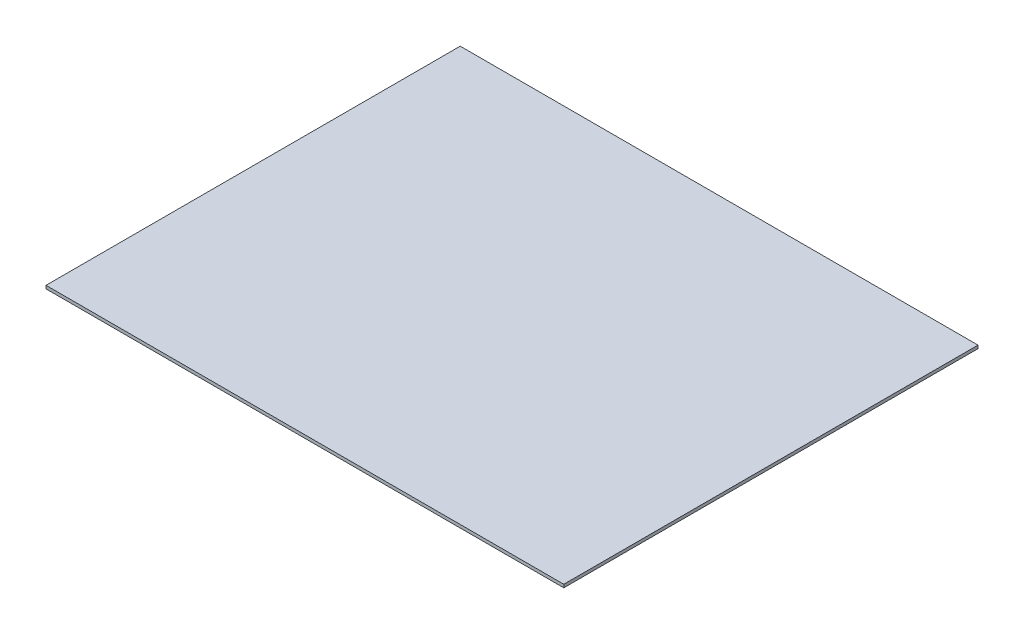
from build123d import *

# Parameters (mm, degrees)
BOSS_EXTRUDE1_DEPTH             = 479.425
BOSS_EXTRUDE1_2_DEPTH           = 479.425
SKETCH2_R                       = 1.5875
SKETCH2_W                       = 5.588
SKETCH2_H                       = 25.4
BOSS_EXTRUDE2_DEPTH             = 3.175
SKETCH3_R                       = 1.5875
BOSS_EXTRUDE3_DEPTH             = 3.175
SKETCH4_R                       = 1.5875
BOSS_EXTRUDE4_DEPTH             = 3.175
BOSS_EXTRUDE5_DEPTH             = 3.175
SKETCH6_R                       = 1.5875
BOSS_EXTRUDE6_DEPTH             = 3.175
BOSS_EXTRUDE8_RIGHT_START       = -0.762
SKETCH8_W                       = 3.175
SKETCH8_H                       = 25.4
BOSS_EXTRUDE8_RIGHT_DEPTH       = 5.588
BOSS_EXTRUDE8_LEFT_START        = -189.738
BOSS_EXTRUDE8_LEFT_OUTLINE_W    = 3.175
BOSS_EXTRUDE8_LEFT_OUTLINE_H    = 25.4
BOSS_EXTRUDE8_LEFT_DEPTH        = 5.588
BASE_FLANGE1_DEPTH              = 482.6
BASE_FLANGE2_DEPTH              = 482.6
SKETCH13_W                      = 0.762
SKETCH13_H                      = 63.5
BASE_FLANGE3_DEPTH              = 482.6
HOLE1_START                     = 93
HOLE1_OUTLINE_R                 = 1.7526
HOLE1_DEPTH                     = 3
HOLE1_START_2                   = 88
HOLE1_2_OUTLINE_R               = 1.7526
HOLE1_2_DEPTH                   = 7
SKETCH24_W                      = 1.35255
SKETCH24_H                      = 184.15
F_6_32_TAPPED_HOLE1_AT_2_COUNT  = 2
F_6_32_TAPPED_HOLE1_AT_2_PITCH  = 152.4
F_6_32_TAPPED_HOLE1_AT_3_COUNT  = 2
F_6_32_TAPPED_HOLE1_AT_3_PITCH  = 304.8
F_6_32_TAPPED_HOLE1_AT_4_COUNT  = 2
F_6_32_TAPPED_HOLE1_AT_4_PITCH  = 457.2
HOLE2_START                     = -96
HOLE2_OUTLINE_R                 = 1.7526
HOLE2_DEPTH                     = 192
HOLE2_START_2                   = -95
HOLE2_2_OUTLINE_R               = 1.7526
HOLE2_2_DEPTH                   = 7
HOLE2_START_3                   = 88
HOLE2_3_OUTLINE_R               = 1.7526
HOLE2_3_DEPTH                   = 7
SKETCH26_W                      = 1.35255
SKETCH26_H                      = 184.15
F_6_32_TAPPED_HOLE2_AT_2_COUNT  = 2
F_6_32_TAPPED_HOLE2_AT_2_PITCH  = 50.8
F_6_32_TAPPED_HOLE2_AT_3_COUNT  = 2
F_6_32_TAPPED_HOLE2_AT_3_PITCH  = 101.6
F_6_32_TAPPED_HOLE2_AT_4_COUNT  = 2
F_6_32_TAPPED_HOLE2_AT_4_PITCH  = 152.4
F_6_32_TAPPED_HOLE2_AT_5_COUNT  = 2
F_6_32_TAPPED_HOLE2_AT_5_PITCH  = 203.2
F_6_32_TAPPED_HOLE2_AT_6_COUNT  = 2
F_6_32_TAPPED_HOLE2_AT_6_PITCH  = 254
F_6_32_TAPPED_HOLE2_AT_7_COUNT  = 2
F_6_32_TAPPED_HOLE2_AT_7_PITCH  = 304.8
F_6_32_TAPPED_HOLE2_AT_8_COUNT  = 2
F_6_32_TAPPED_HOLE2_AT_8_PITCH  = 355.6
F_6_32_TAPPED_HOLE2_AT_9_COUNT  = 2
F_6_32_TAPPED_HOLE2_AT_9_PITCH  = 406.4
F_6_32_TAPPED_HOLE2_AT_10_COUNT = 2
F_6_32_TAPPED_HOLE2_AT_10_PITCH = 457.2
SKETCH21_W                      = 1.35255
SKETCH21_H                      = 3.176
F_6_32_TAPPED_HOLE3_AT_2_COUNT  = 2
F_6_32_TAPPED_HOLE3_AT_2_PITCH  = 25.4
F_6_32_TAPPED_HOLE3_AT_3_COUNT  = 2
F_6_32_TAPPED_HOLE3_AT_3_PITCH  = 50.8
F_6_32_TAPPED_HOLE3_AT_4_COUNT  = 2
F_6_32_TAPPED_HOLE3_AT_4_PITCH  = 76.2
F_6_32_TAPPED_HOLE3_AT_5_COUNT  = 2
F_6_32_TAPPED_HOLE3_AT_5_PITCH  = 101.6
F_6_32_TAPPED_HOLE3_AT_6_COUNT  = 2
F_6_32_TAPPED_HOLE3_AT_6_PITCH  = 127
F_6_32_TAPPED_HOLE3_AT_7_COUNT  = 2
F_6_32_TAPPED_HOLE3_AT_7_PITCH  = 203.2
F_6_32_TAPPED_HOLE3_AT_8_COUNT  = 2
F_6_32_TAPPED_HOLE3_AT_8_PITCH  = 152.4
F_6_32_TAPPED_HOLE3_AT_9_COUNT  = 2
F_6_32_TAPPED_HOLE3_AT_9_PITCH  = 177.8
F_6_32_TAPPED_HOLE3_AT_10_COUNT = 2
F_6_32_TAPPED_HOLE3_AT_10_PITCH = 254
F_6_32_TAPPED_HOLE3_AT_11_COUNT = 2
F_6_32_TAPPED_HOLE3_AT_11_PITCH = 279.4
F_6_32_TAPPED_HOLE3_AT_12_COUNT = 2
F_6_32_TAPPED_HOLE3_AT_12_PITCH = 304.8
F_6_32_TAPPED_HOLE3_AT_13_COUNT = 2
F_6_32_TAPPED_HOLE3_AT_13_PITCH = 330.2
F_6_32_TAPPED_HOLE3_AT_14_COUNT = 2
F_6_32_TAPPED_HOLE3_AT_14_PITCH = 355.6
F_6_32_TAPPED_HOLE3_AT_15_COUNT = 2
F_6_32_TAPPED_HOLE3_AT_15_PITCH = 381
F_6_32_TAPPED_HOLE3_AT_16_COUNT = 2
F_6_32_TAPPED_HOLE3_AT_16_PITCH = 406.4
F_6_32_TAPPED_HOLE3_AT_17_COUNT = 2
F_6_32_TAPPED_HOLE3_AT_17_PITCH = 431.8
MIRROR1_COPY_1_SKETCH_W         = 1.35255
MIRROR1_COPY_1_SKETCH_H         = 3.176
MIRROR1_COPY_2_SKETCH_W         = 1.35255
MIRROR1_COPY_2_SKETCH_H         = 3.176
MIRROR1_COPY_3_SKETCH_W         = 1.35255
MIRROR1_COPY_3_SKETCH_H         = 3.176
MIRROR1_COPY_4_SKETCH_W         = 1.35255
MIRROR1_COPY_4_SKETCH_H         = 3.176
MIRROR1_COPY_5_SKETCH_W         = 1.35255
MIRROR1_COPY_5_SKETCH_H         = 3.176
MIRROR1_COPY_6_SKETCH_W         = 1.35255
MIRROR1_COPY_6_SKETCH_H         = 3.176
MIRROR1_COPY_7_SKETCH_W         = 1.35255
MIRROR1_COPY_7_SKETCH_H         = 3.176
MIRROR1_COPY_8_SKETCH_W         = 1.35255
MIRROR1_COPY_8_SKETCH_H         = 3.176
MIRROR1_COPY_9_SKETCH_W         = 1.35255
MIRROR1_COPY_9_SKETCH_H         = 3.176
MIRROR1_COPY_10_SKETCH_W        = 1.35255
MIRROR1_COPY_10_SKETCH_H        = 3.176
MIRROR1_COPY_11_SKETCH_W        = 1.35255
MIRROR1_COPY_11_SKETCH_H        = 3.176
MIRROR1_COPY_12_SKETCH_W        = 1.35255
MIRROR1_COPY_12_SKETCH_H        = 3.176
MIRROR1_COPY_13_SKETCH_W        = 1.35255
MIRROR1_COPY_13_SKETCH_H        = 3.176
MIRROR1_COPY_14_SKETCH_W        = 1.35255
MIRROR1_COPY_14_SKETCH_H        = 3.176
MIRROR1_COPY_15_SKETCH_W        = 1.35255
MIRROR1_COPY_15_SKETCH_H        = 3.176
MIRROR1_COPY_16_SKETCH_W        = 1.35255
MIRROR1_COPY_16_SKETCH_H        = 3.176
SKETCH9_R                       = 1.5875
NOSECONE_BASE_DEPTH             = 3.175
NOSECONE_BASE_DRAFT             = 20
SPLIT1_START                    = -558.8
SPLIT1_DEPTH                    = 361.95
SPLIT1_START_2                  = -679.45
SPLIT1_2_DEPTH                  = 120.65
SPLIT1_3_OUTLINE_W              = 127
SPLIT1_3_OUTLINE_H              = 0.762
SPLIT1_3_DEPTH                  = 19.05


with BuildPart() as part:
    # Sketch1 → Boss-Extrude1 (new body)
    with BuildSketch(Plane.XY.offset(-196.85)):
        Polygon((88.9, -136.525), (85.725, -136.525), (85.725, -114.3), (63.5, -114.3), (63.5, -111.125), (88.9, -111.125), align=None)
    extrude(amount=-BOSS_EXTRUDE1_DEPTH)

    # Sketch24 → #6-32 Tapped Hole1 (revolve, cut)
    with BuildSketch(Plane(origin=(88.9, -117.475, -209.55), x_dir=(0, 0, -1), z_dir=(0, 1, 0))):
        with Locations((0.676275, 92.075)):
            Rectangle(SKETCH24_W, SKETCH24_H)
    f_6_32_tapped_hole1 = revolve(axis=Axis((95.25, -117.475, -209.55), (-1, 0, 0)), mode=Mode.SUBTRACT)

    # #6-32 Tapped Hole1 at 2: #6-32 Tapped Hole1 ×2
    with Locations(*[(0, 0, -i * F_6_32_TAPPED_HOLE1_AT_2_PITCH) for i in range(1, F_6_32_TAPPED_HOLE1_AT_2_COUNT)]):
        add(f_6_32_tapped_hole1, mode=Mode.SUBTRACT)

    # #6-32 Tapped Hole1 at 3: #6-32 Tapped Hole1 ×2
    with Locations(*[(0, 0, -i * F_6_32_TAPPED_HOLE1_AT_3_PITCH) for i in range(1, F_6_32_TAPPED_HOLE1_AT_3_COUNT)]):
        add(f_6_32_tapped_hole1, mode=Mode.SUBTRACT)

    # #6-32 Tapped Hole1 at 4: #6-32 Tapped Hole1 ×2
    with Locations(*[(0, 0, -i * F_6_32_TAPPED_HOLE1_AT_4_PITCH) for i in range(1, F_6_32_TAPPED_HOLE1_AT_4_COUNT)]):
        add(f_6_32_tapped_hole1, mode=Mode.SUBTRACT)


with BuildPart() as body_2:
    # Sketch1 → Boss-Extrude1 2 (new body)
    with BuildSketch(Plane.XY.offset(-196.85)):
        Polygon((-63.5, -114.3), (-63.5, -111.125), (-88.9, -111.125), (-88.9, -136.525), (-85.725, -136.525), (-85.725, -114.3), align=None)
    extrude(amount=-BOSS_EXTRUDE1_2_DEPTH)


with BuildPart() as body_3:
    # Sketch2 → Boss-Extrude2 (new body)
    # profile 1 of 3: a face of its own
    with BuildSketch(Plane.XY.offset(-196.85)):
        with BuildLine():
            Line((94.488, -171.45), (94.488, -136.525))
            Line((94.488, -136.525), (88.9, -136.525))
            Line((88.9, -136.525), (85.725, -136.525))
            Line((85.725, -136.525), (85.725, -114.3))
            Line((85.725, -114.3), (63.5, -114.3))
            Line((63.5, -114.3), (63.5, -111.125))
            Line((63.5, -111.125), (88.9, -111.125))
            Line((88.9, -111.125), (88.9, -85.725))
            Line((88.9, -85.725), (88.9, -60.325))
            Line((88.9, -60.325), (94.488, -60.325))
            Line((94.488, -60.325), (94.488, -25.4))
            ThreePointArc((94.488, -25.4), (87.271696875, -7.978303125), (69.85, -0.762))
            Line((69.85, -0.762), (-69.85, -0.762))
            ThreePointArc((-69.85, -0.762), (-87.271696875, -7.978303125), (-94.488, -25.4))
            Line((-94.488, -25.4), (-94.488, -60.325))
            Line((-94.488, -60.325), (-88.9, -60.325))
            Line((-88.9, -60.325), (-88.9, -85.725))
            Line((-88.9, -85.725), (-94.488, -85.725))
            Line((-94.488, -85.725), (-94.488, -111.125))
            Line((-94.488, -111.125), (-88.9, -111.125))
            Line((-88.9, -111.125), (-63.5, -111.125))
            Line((-63.5, -111.125), (-63.5, -114.3))
            Line((-63.5, -114.3), (-85.725, -114.3))
            Line((-85.725, -114.3), (-85.725, -136.525))
            Line((-85.725, -136.525), (-88.9, -136.525))
            Line((-88.9, -136.525), (-94.488, -136.525))
            Line((-94.488, -136.525), (-94.488, -171.45))
            ThreePointArc((-94.488, -171.45), (-87.271696875, -188.871696875), (-69.85, -196.088))
            Line((-69.85, -196.088), (69.85, -196.088))
            ThreePointArc((69.85, -196.088), (87.271696875, -188.871696875), (94.488, -171.45))
        make_face()
        with Locations((-19.05, -155.575)):
            Circle(SKETCH2_R, mode=Mode.SUBTRACT)
        with Locations((-19.05, -127)):
            Circle(SKETCH2_R, mode=Mode.SUBTRACT)
        with Locations((19.05, -155.575)):
            Circle(SKETCH2_R, mode=Mode.SUBTRACT)
        with Locations((19.05, -127)):
            Circle(SKETCH2_R, mode=Mode.SUBTRACT)
        with Locations((-83.82, -84.836714101)):
            Circle(SKETCH2_R, mode=Mode.SUBTRACT)
        with BuildLine():
            ThreePointArc((-64.77, -88.9), (-68.362102448, -87.412102448), (-69.85, -83.82))
            Line((-69.85, -83.82), (-69.85, -54.309589078))
            ThreePointArc((-69.85, -54.309589078), (-66.714031836, -49.616281053), (-61.177897552, -50.71748663))
            Line((-61.177897552, -50.71748663), (-31.66748663, -80.227897552))
            ThreePointArc((-31.66748663, -80.227897552), (-30.566281053, -85.764031836), (-35.259589078, -88.9))
            Line((-35.259589078, -88.9), (-64.77, -88.9))
        make_face(mode=Mode.SUBTRACT)
        with BuildLine():
            ThreePointArc((-50.88251337, -34.072102448), (-51.983718947, -28.535968164), (-47.290410922, -25.4))
            Line((-47.290410922, -25.4), (47.290410922, -25.4))
            ThreePointArc((47.290410922, -25.4), (51.983718947, -28.535968164), (50.88251337, -34.072102448))
            Line((50.88251337, -34.072102448), (3.592102448, -81.36251337))
            ThreePointArc((3.592102448, -81.36251337), (0, -82.850410922), (-3.592102448, -81.36251337))
            Line((-3.592102448, -81.36251337), (-50.88251337, -34.072102448))
        make_face(mode=Mode.SUBTRACT)
        with Locations((-19.05, -12.7)):
            Circle(SKETCH2_R, mode=Mode.SUBTRACT)
        with BuildLine():
            Line((64.77, -88.9), (35.259589078, -88.9))
            ThreePointArc((35.259589078, -88.9), (30.566281053, -85.764031836), (31.66748663, -80.227897552))
            Line((31.66748663, -80.227897552), (61.177897552, -50.71748663))
            ThreePointArc((61.177897552, -50.71748663), (66.714031836, -49.616281053), (69.85, -54.309589078))
            Line((69.85, -54.309589078), (69.85, -83.82))
            ThreePointArc((69.85, -83.82), (68.362102448, -87.412102448), (64.77, -88.9))
        make_face(mode=Mode.SUBTRACT)
        with Locations((19.05, -12.7)):
            Circle(SKETCH2_R, mode=Mode.SUBTRACT)
    # profile 2 of 3: a face of its own
    with BuildSketch(Plane.XY.offset(-196.85)):
        with Locations((91.694, -98.425)):
            Rectangle(SKETCH2_W, SKETCH2_H)
    # profile 3 of 3: a face of its own
    with BuildSketch(Plane.XY.offset(-196.85)):
        with BuildLine():
            Line((94.488, -171.45), (94.488, -136.525))
            Line((94.488, -136.525), (88.9, -136.525))
            Line((88.9, -136.525), (85.725, -136.525))
            Line((85.725, -136.525), (85.725, -114.3))
            Line((85.725, -114.3), (63.5, -114.3))
            Line((63.5, -114.3), (63.5, -111.125))
            Line((63.5, -111.125), (88.9, -111.125))
            Line((88.9, -111.125), (88.9, -85.725))
            Line((88.9, -85.725), (88.9, -60.325))
            Line((88.9, -60.325), (94.488, -60.325))
            Line((94.488, -60.325), (94.488, -25.4))
            ThreePointArc((94.488, -25.4), (87.271696875, -7.978303125), (69.85, -0.762))
            Line((69.85, -0.762), (-69.85, -0.762))
            ThreePointArc((-69.85, -0.762), (-87.271696875, -7.978303125), (-94.488, -25.4))
            Line((-94.488, -25.4), (-94.488, -60.325))
            Line((-94.488, -60.325), (-88.9, -60.325))
            Line((-88.9, -60.325), (-88.9, -85.725))
            Line((-88.9, -85.725), (-94.488, -85.725))
            Line((-94.488, -85.725), (-94.488, -111.125))
            Line((-94.488, -111.125), (-88.9, -111.125))
            Line((-88.9, -111.125), (-63.5, -111.125))
            Line((-63.5, -111.125), (-63.5, -114.3))
            Line((-63.5, -114.3), (-85.725, -114.3))
            Line((-85.725, -114.3), (-85.725, -136.525))
            Line((-85.725, -136.525), (-88.9, -136.525))
            Line((-88.9, -136.525), (-94.488, -136.525))
            Line((-94.488, -136.525), (-94.488, -171.45))
            ThreePointArc((-94.488, -171.45), (-87.271696875, -188.871696875), (-69.85, -196.088))
            Line((-69.85, -196.088), (69.85, -196.088))
            ThreePointArc((69.85, -196.088), (87.271696875, -188.871696875), (94.488, -171.45))
        make_face()
        with Locations((-19.05, -155.575)):
            Circle(SKETCH2_R, mode=Mode.SUBTRACT)
        with Locations((-19.05, -127)):
            Circle(SKETCH2_R, mode=Mode.SUBTRACT)
        with Locations((19.05, -155.575)):
            Circle(SKETCH2_R, mode=Mode.SUBTRACT)
        with Locations((19.05, -127)):
            Circle(SKETCH2_R, mode=Mode.SUBTRACT)
        with Locations((-83.82, -84.836714101)):
            Circle(SKETCH2_R, mode=Mode.SUBTRACT)
        with BuildLine():
            ThreePointArc((-64.77, -88.9), (-68.362102448, -87.412102448), (-69.85, -83.82))
            Line((-69.85, -83.82), (-69.85, -54.309589078))
            ThreePointArc((-69.85, -54.309589078), (-66.714031836, -49.616281053), (-61.177897552, -50.71748663))
            Line((-61.177897552, -50.71748663), (-31.66748663, -80.227897552))
            ThreePointArc((-31.66748663, -80.227897552), (-30.566281053, -85.764031836), (-35.259589078, -88.9))
            Line((-35.259589078, -88.9), (-64.77, -88.9))
        make_face(mode=Mode.SUBTRACT)
        with BuildLine():
            ThreePointArc((-50.88251337, -34.072102448), (-51.983718947, -28.535968164), (-47.290410922, -25.4))
            Line((-47.290410922, -25.4), (47.290410922, -25.4))
            ThreePointArc((47.290410922, -25.4), (51.983718947, -28.535968164), (50.88251337, -34.072102448))
            Line((50.88251337, -34.072102448), (3.592102448, -81.36251337))
            ThreePointArc((3.592102448, -81.36251337), (0, -82.850410922), (-3.592102448, -81.36251337))
            Line((-3.592102448, -81.36251337), (-50.88251337, -34.072102448))
        make_face(mode=Mode.SUBTRACT)
        with Locations((-19.05, -12.7)):
            Circle(SKETCH2_R, mode=Mode.SUBTRACT)
        with BuildLine():
            Line((64.77, -88.9), (35.259589078, -88.9))
            ThreePointArc((35.259589078, -88.9), (30.566281053, -85.764031836), (31.66748663, -80.227897552))
            Line((31.66748663, -80.227897552), (61.177897552, -50.71748663))
            ThreePointArc((61.177897552, -50.71748663), (66.714031836, -49.616281053), (69.85, -54.309589078))
            Line((69.85, -54.309589078), (69.85, -83.82))
            ThreePointArc((69.85, -83.82), (68.362102448, -87.412102448), (64.77, -88.9))
        make_face(mode=Mode.SUBTRACT)
        with Locations((19.05, -12.7)):
            Circle(SKETCH2_R, mode=Mode.SUBTRACT)
    extrude(amount=-BOSS_EXTRUDE2_DEPTH)


with BuildPart() as body_4:
    # Sketch3 → Boss-Extrude3 (new body)
    with BuildSketch(Plane.XY.offset(-450.85)):
        Polygon((88.9, -111.125), (63.5, -111.125), (63.5, -114.3), (85.725, -114.3), (85.725, -136.525), (-85.725, -136.525), (-85.725, -114.3), (-63.5, -114.3), (-63.5, -111.125), (-88.9, -111.125), (-94.488, -111.125), (-94.488, -85.725), (-88.9, -85.725), (-88.9, -60.325), (88.9, -60.325), (88.9, -85.725), (94.488, -85.725), (94.488, -111.125), align=None)
        with Locations((-83.82, -84.836714101)):
            Circle(SKETCH3_R, mode=Mode.SUBTRACT)
        with BuildLine():
            Line((-25.4, -85.725), (25.4, -85.725))
            ThreePointArc((25.4, -85.725), (38.1, -98.425), (25.4, -111.125))
            Line((25.4, -111.125), (-25.4, -111.125))
            ThreePointArc((-25.4, -111.125), (-38.1, -98.425), (-25.4, -85.725))
        make_face(mode=Mode.SUBTRACT)
    extrude(amount=BOSS_EXTRUDE3_DEPTH)


with BuildPart() as body_5:
    # Sketch4 → Boss-Extrude4 (new body)
    with BuildSketch(Plane.XY.offset(-679.45)):
        with BuildLine():
            Line((88.9, -136.525), (88.9, -111.125))
            Line((88.9, -111.125), (94.488, -111.125))
            Line((94.488, -111.125), (94.488, -85.725))
            Line((94.488, -85.725), (88.9, -85.725))
            Line((88.9, -85.725), (88.9, -60.325))
            Line((88.9, -60.325), (94.488, -60.325))
            Line((94.488, -60.325), (94.488, -25.4))
            ThreePointArc((94.488, -25.4), (87.271696875, -7.978303125), (69.85, -0.762))
            Line((69.85, -0.762), (-69.85, -0.762))
            ThreePointArc((-69.85, -0.762), (-87.271696875, -7.978303125), (-94.488, -25.4))
            Line((-94.488, -25.4), (-94.488, -60.325))
            Line((-94.488, -60.325), (-88.9, -60.325))
            Line((-88.9, -60.325), (-88.9, -85.725))
            Line((-88.9, -85.725), (-94.488, -85.725))
            Line((-94.488, -85.725), (-94.488, -111.125))
            Line((-94.488, -111.125), (-88.9, -111.125))
            Line((-88.9, -111.125), (-88.9, -136.525))
            Line((-88.9, -136.525), (-94.488, -136.525))
            Line((-94.488, -136.525), (-94.488, -171.45))
            ThreePointArc((-94.488, -171.45), (-87.271696875, -188.871696875), (-69.85, -196.088))
            Line((-69.85, -196.088), (69.85, -196.088))
            ThreePointArc((69.85, -196.088), (87.271696875, -188.871696875), (94.488, -171.45))
            Line((94.488, -171.45), (94.488, -136.525))
            Line((94.488, -136.525), (88.9, -136.525))
        make_face()
        with Locations((25.4, -184.15)):
            Circle(SKETCH4_R, mode=Mode.SUBTRACT)
        with Locations(Location((-25.4, -184.15, 0), (0, 0, 180))):
            Circle(SKETCH4_R, mode=Mode.SUBTRACT)
        with Locations(Location((-63.1655201, -45.2492872, 0), (0, 0, 180))):
            Circle(SKETCH4_R, mode=Mode.SUBTRACT)
        with Locations(Location((-63.1655201, -133.35, 0), (0, 0, 180))):
            Circle(SKETCH4_R, mode=Mode.SUBTRACT)
        with Locations((63.1655201, -45.2492872)):
            Circle(SKETCH4_R, mode=Mode.SUBTRACT)
        with Locations((63.1655201, -133.35)):
            Circle(SKETCH4_R, mode=Mode.SUBTRACT)
        with Locations((-83.82, -84.836714101)):
            Circle(SKETCH4_R, mode=Mode.SUBTRACT)
        with BuildLine():
            Line((-3.271622644, -113.630048555), (-49.273936974, -152.356965567))
            ThreePointArc((-49.273936974, -152.356965567), (-50.774552528, -157.984513496), (-46.00231433, -161.323208647))
            Line((-46.00231433, -161.323208647), (46.00231433, -161.323208647))
            ThreePointArc((46.00231433, -161.323208647), (50.774552528, -157.984513496), (49.273936974, -152.356965567))
            Line((49.273936974, -152.356965567), (3.271622644, -113.630048555))
            ThreePointArc((3.271622644, -113.630048555), (0, -112.436291635), (-3.271622644, -113.630048555))
        make_face(mode=Mode.SUBTRACT)
        with BuildLine():
            Line((-46.00231433, -35.526791353), (46.00231433, -35.526791353))
            ThreePointArc((46.00231433, -35.526791353), (50.774552528, -38.865486504), (49.273936974, -44.493034433))
            Line((49.273936974, -44.493034433), (3.271622644, -83.219951445))
            ThreePointArc((3.271622644, -83.219951445), (0, -84.413708365), (-3.271622644, -83.219951445))
            Line((-3.271622644, -83.219951445), (-49.273936974, -44.493034433))
            ThreePointArc((-49.273936974, -44.493034433), (-50.774552528, -38.865486504), (-46.00231433, -35.526791353))
        make_face(mode=Mode.SUBTRACT)
        with BuildLine():
            Line((25.440586882, -89.45875692), (54.813897456, -64.730919255))
            ThreePointArc((54.813897456, -64.730919255), (60.228713625, -64.011391876), (63.1655201, -68.617162335))
            Line((63.1655201, -68.617162335), (63.1655201, -93.345))
            ThreePointArc((63.1655201, -93.345), (61.677622548, -96.937102448), (58.0855201, -98.425))
            Line((58.0855201, -98.425), (28.712209526, -98.425))
            ThreePointArc((28.712209526, -98.425), (23.939971328, -95.086304849), (25.440586882, -89.45875692))
        make_face(mode=Mode.SUBTRACT)
        with BuildLine():
            Line((-63.1655201, -68.617162335), (-63.1655201, -93.345))
            ThreePointArc((-63.1655201, -93.345), (-61.677622548, -96.937102448), (-58.0855201, -98.425))
            Line((-58.0855201, -98.425), (-28.712209526, -98.425))
            ThreePointArc((-28.712209526, -98.425), (-23.939971328, -95.086304849), (-25.440586882, -89.45875692))
            Line((-25.440586882, -89.45875692), (-54.813897456, -64.730919255))
            ThreePointArc((-54.813897456, -64.730919255), (-60.228713625, -64.011391876), (-63.1655201, -68.617162335))
        make_face(mode=Mode.SUBTRACT)
    extrude(amount=BOSS_EXTRUDE4_DEPTH)


with BuildPart() as body_6:
    # Sketch5 → Boss-Extrude5 (new body)
    with BuildSketch(Plane.XY.offset(-450.85)):
        with BuildLine():
            Line((69.85, -0.762), (69.85, -1.203250218))
            ThreePointArc((69.85, -1.203250218), (83.566, -10.002068321), (88.9, -25.4))
            Line((88.9, -25.4), (88.9, -60.325))
            Line((88.9, -60.325), (94.488, -60.325))
            Line((94.488, -60.325), (94.488, -25.4))
            ThreePointArc((94.488, -25.4), (87.271696875, -7.978303125), (69.85, -0.762))
        make_face()
    extrude(amount=-BOSS_EXTRUDE5_DEPTH)


with BuildPart() as body_7:
    # Sketch6 → Boss-Extrude6 (new body)
    with BuildSketch(Plane.XY.offset(-450.85)):
        with BuildLine():
            Line((-94.488, -25.4), (-94.488, -59.98389124))
            ThreePointArc((-94.488, -59.98389124), (-66.117668406, -64.389306336), (-57.695875243, -91.836652233))
            Line((-57.695875243, -91.836652233), (-61.777576564, -96.701034447))
            Line((-61.777576564, -96.701034447), (-80.554638943, -80.94520833))
            ThreePointArc((-80.554638943, -80.94520833), (-87.711505771, -81.571353044), (-87.085361057, -88.728219872))
            Line((-87.085361057, -88.728219872), (-68.308298678, -104.484045989))
            Line((-68.308298678, -104.484045989), (-58.302651908, -106.248311474))
            Line((-58.302651908, -106.248311474), (-50.955589529, -97.492423489))
            ThreePointArc((-50.955589529, -97.492423489), (-45.450014055, -78.708264177), (-55.529491864, -61.928510619))
            Line((-55.529491864, -61.928510619), (-78.407186312, -45.704558542))
            ThreePointArc((-78.407186312, -45.704558542), (-88.452181648, -20.699611978), (-69.85, -1.203250218))
            Line((-69.85, -1.203250218), (-69.85, -0.762))
            ThreePointArc((-69.85, -0.762), (-87.271696875, -7.978303125), (-94.488, -25.4))
        make_face()
        with Locations((-83.82, -84.836714101)):
            Circle(SKETCH6_R, mode=Mode.SUBTRACT)
    extrude(amount=-BOSS_EXTRUDE6_DEPTH)


with BuildPart() as body_8:
    # Sketch8 → Boss-Extrude8-Right (new body)
    with BuildSketch(Plane(origin=(95.25, 0, 0), x_dir=(0, 0, -1), z_dir=(1, 0, 0)).offset(BOSS_EXTRUDE8_RIGHT_START)):
        Polygon((196.85, -60.325), (679.45, -60.325), (679.45, -85.725), (676.275, -85.725), (676.275, -111.125), (679.45, -111.125), (679.45, -136.525), (196.85, -136.525), (196.85, -111.125), (200.025, -111.125), (200.025, -85.725), (196.85, -85.725), align=None)
        with Locations((449.2625, -98.425)):
            Rectangle(SKETCH8_W, SKETCH8_H, mode=Mode.SUBTRACT)
    extrude(amount=-BOSS_EXTRUDE8_RIGHT_DEPTH)

    # Hole1 2 outline → Hole1 2 (cut)
    with BuildSketch(Plane.YZ.offset(HOLE1_START_2)):
        with Locations((-117.475, -666.75)):
            Circle(HOLE1_2_OUTLINE_R)
        with Locations((-117.475, -514.35)):
            Circle(HOLE1_2_OUTLINE_R)
        with Locations((-117.475, -361.95)):
            Circle(HOLE1_2_OUTLINE_R)
        with Locations((-117.475, -209.55)):
            Circle(HOLE1_2_OUTLINE_R)
    extrude(amount=HOLE1_2_DEPTH, mode=Mode.SUBTRACT)

    # Hole2 3 outline → Hole2 3 (cut)
    with BuildSketch(Plane.YZ.offset(HOLE2_START_3)):
        with Locations((-130.175, -666.75)):
            Circle(HOLE2_3_OUTLINE_R)
        with Locations((-130.175, -615.95)):
            Circle(HOLE2_3_OUTLINE_R)
        with Locations((-130.175, -565.15)):
            Circle(HOLE2_3_OUTLINE_R)
        with Locations((-130.175, -514.35)):
            Circle(HOLE2_3_OUTLINE_R)
        with Locations((-130.175, -463.55)):
            Circle(HOLE2_3_OUTLINE_R)
        with Locations((-130.175, -412.75)):
            Circle(HOLE2_3_OUTLINE_R)
        with Locations((-130.175, -361.95)):
            Circle(HOLE2_3_OUTLINE_R)
        with Locations((-130.175, -311.15)):
            Circle(HOLE2_3_OUTLINE_R)
        with Locations((-130.175, -260.35)):
            Circle(HOLE2_3_OUTLINE_R)
        with Locations((-130.175, -209.55)):
            Circle(HOLE2_3_OUTLINE_R)
    extrude(amount=HOLE2_3_DEPTH, mode=Mode.SUBTRACT)


with BuildPart() as body_9:
    # Boss-Extrude8-Left: read off the stored shape, not the designer's step
    # Boss-Extrude8-Left outline → Boss-Extrude8-Left (new body)
    with BuildSketch(Plane(origin=(95.25, 0, 0), x_dir=(0, 0, -1), z_dir=(1, 0, 0)).offset(BOSS_EXTRUDE8_LEFT_START)):
        Polygon((196.85, -60.325), (196.85, -85.725), (200.025, -85.725), (200.025, -111.125), (196.85, -111.125), (196.85, -136.525), (679.45, -136.525), (679.45, -111.125), (676.275, -111.125), (676.275, -85.725), (679.45, -85.725), (679.45, -60.325), align=None)
        with Locations((449.2625, -98.425)):
            Rectangle(BOSS_EXTRUDE8_LEFT_OUTLINE_W, BOSS_EXTRUDE8_LEFT_OUTLINE_H, mode=Mode.SUBTRACT)
    extrude(amount=BOSS_EXTRUDE8_LEFT_DEPTH)

    # Hole2 2 outline → Hole2 2 (cut)
    with BuildSketch(Plane.YZ.offset(HOLE2_START_2)):
        with Locations((-130.175, -666.75)):
            Circle(HOLE2_2_OUTLINE_R)
        with Locations((-130.175, -615.95)):
            Circle(HOLE2_2_OUTLINE_R)
        with Locations((-130.175, -565.15)):
            Circle(HOLE2_2_OUTLINE_R)
        with Locations((-130.175, -514.35)):
            Circle(HOLE2_2_OUTLINE_R)
        with Locations((-130.175, -463.55)):
            Circle(HOLE2_2_OUTLINE_R)
        with Locations((-130.175, -412.75)):
            Circle(HOLE2_2_OUTLINE_R)
        with Locations((-130.175, -361.95)):
            Circle(HOLE2_2_OUTLINE_R)
        with Locations((-130.175, -311.15)):
            Circle(HOLE2_2_OUTLINE_R)
        with Locations((-130.175, -260.35)):
            Circle(HOLE2_2_OUTLINE_R)
        with Locations((-130.175, -209.55)):
            Circle(HOLE2_2_OUTLINE_R)
    extrude(amount=HOLE2_2_DEPTH, mode=Mode.SUBTRACT)


with BuildPart() as body_10:
    # Base-Flange1: sheet metal written as solids
    # Sketch11 → Base-Flange1 (new body)
    with BuildSketch(Plane.XY.offset(-196.85)):
        with BuildLine():
            Line((95.25, -123.825), (95.25, -25.4))
            ThreePointArc((95.25, -25.4), (87.810512242, -7.439487758), (69.85, 0))
            Line((69.85, 0), (-69.85, 0))
            ThreePointArc((-69.85, 0), (-87.810512242, -7.439487758), (-95.25, -25.4))
            Line((-95.25, -25.4), (-95.25, -60.325))
            Line((-95.25, -60.325), (-94.488, -60.325))
            Line((-94.488, -60.325), (-94.488, -25.4))
            ThreePointArc((-94.488, -25.4), (-87.271696875, -7.978303125), (-69.85, -0.762))
            Line((-69.85, -0.762), (69.85, -0.762))
            ThreePointArc((69.85, -0.762), (87.271696875, -7.978303125), (94.488, -25.4))
            Line((94.488, -25.4), (94.488, -123.825))
            Line((94.488, -123.825), (95.25, -123.825))
        make_face()
    extrude(amount=-BASE_FLANGE1_DEPTH)

    # Hole1: read off the stored shape, not the designer's step
    # Hole1 outline → Hole1 (cut)
    with BuildSketch(Plane.YZ.offset(HOLE1_START)):
        with Locations((-117.475, -666.75)):
            Circle(HOLE1_OUTLINE_R)
        with Locations((-117.475, -514.35)):
            Circle(HOLE1_OUTLINE_R)
        with Locations((-117.475, -361.95)):
            Circle(HOLE1_OUTLINE_R)
        with Locations((-117.475, -209.55)):
            Circle(HOLE1_OUTLINE_R)
    extrude(amount=HOLE1_DEPTH, mode=Mode.SUBTRACT)


with BuildPart() as body_11:
    # Base-Flange2: sheet metal written as solids
    # Sketch12 → Base-Flange2 (new body)
    with BuildSketch(Plane.XY.offset(-196.85)):
        with BuildLine():
            Line((-95.25, -123.825), (-95.25, -171.45))
            ThreePointArc((-95.25, -171.45), (-87.810512242, -189.410512242), (-69.85, -196.85))
            Line((-69.85, -196.85), (69.85, -196.85))
            ThreePointArc((69.85, -196.85), (87.810512242, -189.410512242), (95.25, -171.45))
            Line((95.25, -171.45), (95.25, -123.825))
            Line((95.25, -123.825), (94.488, -123.825))
            Line((94.488, -123.825), (94.488, -171.45))
            ThreePointArc((94.488, -171.45), (87.271696875, -188.871696875), (69.85, -196.088))
            Line((69.85, -196.088), (-69.85, -196.088))
            ThreePointArc((-69.85, -196.088), (-87.271696875, -188.871696875), (-94.488, -171.45))
            Line((-94.488, -171.45), (-94.488, -123.825))
            Line((-94.488, -123.825), (-95.25, -123.825))
        make_face()
    extrude(amount=-BASE_FLANGE2_DEPTH)

    # Hole2: read off the stored shape, not the designer's step
    # Hole2 outline → Hole2 (cut)
    with BuildSketch(Plane.YZ.offset(HOLE2_START)):
        with Locations((-130.175, -666.75)):
            Circle(HOLE2_OUTLINE_R)
        with Locations((-130.175, -615.95)):
            Circle(HOLE2_OUTLINE_R)
        with Locations((-130.175, -565.15)):
            Circle(HOLE2_OUTLINE_R)
        with Locations((-130.175, -514.35)):
            Circle(HOLE2_OUTLINE_R)
        with Locations((-130.175, -463.55)):
            Circle(HOLE2_OUTLINE_R)
        with Locations((-130.175, -412.75)):
            Circle(HOLE2_OUTLINE_R)
        with Locations((-130.175, -361.95)):
            Circle(HOLE2_OUTLINE_R)
        with Locations((-130.175, -311.15)):
            Circle(HOLE2_OUTLINE_R)
        with Locations((-130.175, -260.35)):
            Circle(HOLE2_OUTLINE_R)
        with Locations((-130.175, -209.55)):
            Circle(HOLE2_OUTLINE_R)
    extrude(amount=HOLE2_DEPTH, mode=Mode.SUBTRACT)

    # Split1: read off the stored shape, not the designer's step
    # Split1 outline → Split1 (cut)
    with BuildSketch(Plane.XY.offset(SPLIT1_START)):
        with BuildLine():
            Line((69.85, -196.088), (-69.85, -196.088))
            ThreePointArc((-69.85, -196.088), (-87.271696875, -188.871696875), (-94.488, -171.45))
            Line((-94.488, -171.45), (-94.488, -123.825))
            Line((-94.488, -123.825), (-95.25, -123.825))
            Line((-95.25, -123.825), (-95.25, -171.45))
            ThreePointArc((-95.25, -171.45), (-87.810512242, -189.410512242), (-69.85, -196.85))
            Line((-69.85, -196.85), (69.85, -196.85))
            ThreePointArc((69.85, -196.85), (87.810512242, -189.410512242), (95.25, -171.45))
            Line((95.25, -171.45), (95.25, -123.825))
            Line((95.25, -123.825), (94.488, -123.825))
            Line((94.488, -123.825), (94.488, -171.45))
            ThreePointArc((94.488, -171.45), (87.271696875, -188.871696875), (69.85, -196.088))
        make_face()
    extrude(amount=SPLIT1_DEPTH, mode=Mode.SUBTRACT)

    # Split1 2 outline → Split1 2 (cut)
    with BuildSketch(Plane.XY.offset(SPLIT1_START_2)):
        with BuildLine():
            Line((69.85, -196.088), (63.5, -196.088))
            Line((63.5, -196.088), (63.5, -196.85))
            Line((63.5, -196.85), (69.85, -196.85))
            ThreePointArc((69.85, -196.85), (87.810512242, -189.410512242), (95.25, -171.45))
            Line((95.25, -171.45), (95.25, -123.825))
            Line((95.25, -123.825), (94.488, -123.825))
            Line((94.488, -123.825), (94.488, -171.45))
            ThreePointArc((94.488, -171.45), (87.271696875, -188.871696875), (69.85, -196.088))
        make_face()
        with BuildLine():
            Line((-63.5, -196.85), (-63.5, -196.088))
            Line((-63.5, -196.088), (-69.85, -196.088))
            ThreePointArc((-69.85, -196.088), (-87.271696875, -188.871696875), (-94.488, -171.45))
            Line((-94.488, -171.45), (-94.488, -123.825))
            Line((-94.488, -123.825), (-95.25, -123.825))
            Line((-95.25, -123.825), (-95.25, -171.45))
            ThreePointArc((-95.25, -171.45), (-87.810512242, -189.410512242), (-69.85, -196.85))
            Line((-69.85, -196.85), (-63.5, -196.85))
        make_face()
    extrude(amount=SPLIT1_2_DEPTH, mode=Mode.SUBTRACT)

    # Split1 3 outline → Split1 3 (cut)
    with BuildSketch(Plane.XY.offset(SPLIT1_START_2)):
        with Locations((0, -196.469)):
            Rectangle(SPLIT1_3_OUTLINE_W, SPLIT1_3_OUTLINE_H)
    extrude(amount=SPLIT1_3_DEPTH, mode=Mode.SUBTRACT)


with BuildPart() as body_12:
    # Base-Flange3: sheet metal written as solids
    # Sketch13 → Base-Flange3 (new body)
    with BuildSketch(Plane.XY.offset(-196.85)):
        with Locations((-94.869, -92.075)):
            Rectangle(SKETCH13_W, SKETCH13_H)
    extrude(amount=-BASE_FLANGE3_DEPTH)


with BuildPart() as f_6_32_tapped_hole2_tool:
    # Sketch26 → #6-32 Tapped Hole2 (revolve)
    with BuildSketch(Plane(origin=(88.9, -130.175, -209.55), x_dir=(0, 0, -1), z_dir=(0, 1, 0))):
        with Locations((0.676275, 92.075)):
            Rectangle(SKETCH26_W, SKETCH26_H)
    f_6_32_tapped_hole2 = revolve(axis=Axis((95.25, -130.175, -209.55), (-1, 0, 0)))


with BuildPart() as part_1:
    add(part.part)

    # #6-32 Tapped Hole2: cut by f_6_32_tapped_hole2_tool
    add(f_6_32_tapped_hole2_tool.part, mode=Mode.SUBTRACT)


with BuildPart() as body_2_1:
    add(body_2.part)

    # #6-32 Tapped Hole2: cut by f_6_32_tapped_hole2_tool
    add(f_6_32_tapped_hole2_tool.part, mode=Mode.SUBTRACT)


with BuildPart() as f_6_32_tapped_hole2_at_2_tool:
    # #6-32 Tapped Hole2 at 2: #6-32 Tapped Hole2 ×2
    with Locations(*[(0, 0, -i * F_6_32_TAPPED_HOLE2_AT_2_PITCH) for i in range(1, F_6_32_TAPPED_HOLE2_AT_2_COUNT)]):
        add(f_6_32_tapped_hole2)


with BuildPart() as part_2:
    add(part_1.part)

    # #6-32 Tapped Hole2 at 2: cut by f_6_32_tapped_hole2_at_2_tool
    add(f_6_32_tapped_hole2_at_2_tool.part, mode=Mode.SUBTRACT)


with BuildPart() as body_2_2:
    add(body_2_1.part)

    # #6-32 Tapped Hole2 at 2: cut by f_6_32_tapped_hole2_at_2_tool
    add(f_6_32_tapped_hole2_at_2_tool.part, mode=Mode.SUBTRACT)


with BuildPart() as f_6_32_tapped_hole2_at_3_tool:
    # #6-32 Tapped Hole2 at 3: #6-32 Tapped Hole2 ×2
    with Locations(*[(0, 0, -i * F_6_32_TAPPED_HOLE2_AT_3_PITCH) for i in range(1, F_6_32_TAPPED_HOLE2_AT_3_COUNT)]):
        add(f_6_32_tapped_hole2)


with BuildPart() as part_3:
    add(part_2.part)

    # #6-32 Tapped Hole2 at 3: cut by f_6_32_tapped_hole2_at_3_tool
    add(f_6_32_tapped_hole2_at_3_tool.part, mode=Mode.SUBTRACT)


with BuildPart() as body_2_3:
    add(body_2_2.part)

    # #6-32 Tapped Hole2 at 3: cut by f_6_32_tapped_hole2_at_3_tool
    add(f_6_32_tapped_hole2_at_3_tool.part, mode=Mode.SUBTRACT)


with BuildPart() as f_6_32_tapped_hole2_at_4_tool:
    # #6-32 Tapped Hole2 at 4: #6-32 Tapped Hole2 ×2
    with Locations(*[(0, 0, -i * F_6_32_TAPPED_HOLE2_AT_4_PITCH) for i in range(1, F_6_32_TAPPED_HOLE2_AT_4_COUNT)]):
        add(f_6_32_tapped_hole2)


with BuildPart() as part_4:
    add(part_3.part)

    # #6-32 Tapped Hole2 at 4: cut by f_6_32_tapped_hole2_at_4_tool
    add(f_6_32_tapped_hole2_at_4_tool.part, mode=Mode.SUBTRACT)


with BuildPart() as body_2_4:
    add(body_2_3.part)

    # #6-32 Tapped Hole2 at 4: cut by f_6_32_tapped_hole2_at_4_tool
    add(f_6_32_tapped_hole2_at_4_tool.part, mode=Mode.SUBTRACT)


with BuildPart() as f_6_32_tapped_hole2_at_5_tool:
    # #6-32 Tapped Hole2 at 5: #6-32 Tapped Hole2 ×2
    with Locations(*[(0, 0, -i * F_6_32_TAPPED_HOLE2_AT_5_PITCH) for i in range(1, F_6_32_TAPPED_HOLE2_AT_5_COUNT)]):
        add(f_6_32_tapped_hole2)


with BuildPart() as part_5:
    add(part_4.part)

    # #6-32 Tapped Hole2 at 5: cut by f_6_32_tapped_hole2_at_5_tool
    add(f_6_32_tapped_hole2_at_5_tool.part, mode=Mode.SUBTRACT)


with BuildPart() as body_2_5:
    add(body_2_4.part)

    # #6-32 Tapped Hole2 at 5: cut by f_6_32_tapped_hole2_at_5_tool
    add(f_6_32_tapped_hole2_at_5_tool.part, mode=Mode.SUBTRACT)


with BuildPart() as f_6_32_tapped_hole2_at_6_tool:
    # #6-32 Tapped Hole2 at 6: #6-32 Tapped Hole2 ×2
    with Locations(*[(0, 0, -i * F_6_32_TAPPED_HOLE2_AT_6_PITCH) for i in range(1, F_6_32_TAPPED_HOLE2_AT_6_COUNT)]):
        add(f_6_32_tapped_hole2)


with BuildPart() as part_6:
    add(part_5.part)

    # #6-32 Tapped Hole2 at 6: cut by f_6_32_tapped_hole2_at_6_tool
    add(f_6_32_tapped_hole2_at_6_tool.part, mode=Mode.SUBTRACT)


with BuildPart() as body_2_6:
    add(body_2_5.part)

    # #6-32 Tapped Hole2 at 6: cut by f_6_32_tapped_hole2_at_6_tool
    add(f_6_32_tapped_hole2_at_6_tool.part, mode=Mode.SUBTRACT)


with BuildPart() as f_6_32_tapped_hole2_at_7_tool:
    # #6-32 Tapped Hole2 at 7: #6-32 Tapped Hole2 ×2
    with Locations(*[(0, 0, -i * F_6_32_TAPPED_HOLE2_AT_7_PITCH) for i in range(1, F_6_32_TAPPED_HOLE2_AT_7_COUNT)]):
        add(f_6_32_tapped_hole2)


with BuildPart() as part_7:
    add(part_6.part)

    # #6-32 Tapped Hole2 at 7: cut by f_6_32_tapped_hole2_at_7_tool
    add(f_6_32_tapped_hole2_at_7_tool.part, mode=Mode.SUBTRACT)


with BuildPart() as body_2_7:
    add(body_2_6.part)

    # #6-32 Tapped Hole2 at 7: cut by f_6_32_tapped_hole2_at_7_tool
    add(f_6_32_tapped_hole2_at_7_tool.part, mode=Mode.SUBTRACT)


with BuildPart() as f_6_32_tapped_hole2_at_8_tool:
    # #6-32 Tapped Hole2 at 8: #6-32 Tapped Hole2 ×2
    with Locations(*[(0, 0, -i * F_6_32_TAPPED_HOLE2_AT_8_PITCH) for i in range(1, F_6_32_TAPPED_HOLE2_AT_8_COUNT)]):
        add(f_6_32_tapped_hole2)


with BuildPart() as part_8:
    add(part_7.part)

    # #6-32 Tapped Hole2 at 8: cut by f_6_32_tapped_hole2_at_8_tool
    add(f_6_32_tapped_hole2_at_8_tool.part, mode=Mode.SUBTRACT)


with BuildPart() as body_2_8:
    add(body_2_7.part)

    # #6-32 Tapped Hole2 at 8: cut by f_6_32_tapped_hole2_at_8_tool
    add(f_6_32_tapped_hole2_at_8_tool.part, mode=Mode.SUBTRACT)


with BuildPart() as f_6_32_tapped_hole2_at_9_tool:
    # #6-32 Tapped Hole2 at 9: #6-32 Tapped Hole2 ×2
    with Locations(*[(0, 0, -i * F_6_32_TAPPED_HOLE2_AT_9_PITCH) for i in range(1, F_6_32_TAPPED_HOLE2_AT_9_COUNT)]):
        add(f_6_32_tapped_hole2)


with BuildPart() as part_9:
    add(part_8.part)

    # #6-32 Tapped Hole2 at 9: cut by f_6_32_tapped_hole2_at_9_tool
    add(f_6_32_tapped_hole2_at_9_tool.part, mode=Mode.SUBTRACT)


with BuildPart() as body_2_9:
    add(body_2_8.part)

    # #6-32 Tapped Hole2 at 9: cut by f_6_32_tapped_hole2_at_9_tool
    add(f_6_32_tapped_hole2_at_9_tool.part, mode=Mode.SUBTRACT)


with BuildPart() as f_6_32_tapped_hole2_at_10_tool:
    # #6-32 Tapped Hole2 at 10: #6-32 Tapped Hole2 ×2
    with Locations(*[(0, 0, -i * F_6_32_TAPPED_HOLE2_AT_10_PITCH) for i in range(1, F_6_32_TAPPED_HOLE2_AT_10_COUNT)]):
        add(f_6_32_tapped_hole2)


with BuildPart() as part_10:
    add(part_9.part)

    # #6-32 Tapped Hole2 at 10: cut by f_6_32_tapped_hole2_at_10_tool
    add(f_6_32_tapped_hole2_at_10_tool.part, mode=Mode.SUBTRACT)

    # Sketch21 → #6-32 Tapped Hole3 (revolve, cut)
    with BuildSketch(Plane(origin=(76.2, -111.125, -222.25), x_dir=(0, 0, 1), z_dir=(1, 0, 0))):
        with Locations((0.676275, 1.588)):
            Rectangle(SKETCH21_W, SKETCH21_H)
    f_6_32_tapped_hole3 = revolve(axis=Axis((76.2, -104.775, -222.25), (0, -1, 0)), mode=Mode.SUBTRACT)

    # #6-32 Tapped Hole3 at 2: #6-32 Tapped Hole3 ×2
    with Locations(*[(0, 0, -i * F_6_32_TAPPED_HOLE3_AT_2_PITCH) for i in range(1, F_6_32_TAPPED_HOLE3_AT_2_COUNT)]):
        add(f_6_32_tapped_hole3, mode=Mode.SUBTRACT)

    # #6-32 Tapped Hole3 at 3: #6-32 Tapped Hole3 ×2
    with Locations(*[(0, 0, -i * F_6_32_TAPPED_HOLE3_AT_3_PITCH) for i in range(1, F_6_32_TAPPED_HOLE3_AT_3_COUNT)]):
        add(f_6_32_tapped_hole3, mode=Mode.SUBTRACT)

    # #6-32 Tapped Hole3 at 4: #6-32 Tapped Hole3 ×2
    with Locations(*[(0, 0, -i * F_6_32_TAPPED_HOLE3_AT_4_PITCH) for i in range(1, F_6_32_TAPPED_HOLE3_AT_4_COUNT)]):
        add(f_6_32_tapped_hole3, mode=Mode.SUBTRACT)

    # #6-32 Tapped Hole3 at 5: #6-32 Tapped Hole3 ×2
    with Locations(*[(0, 0, -i * F_6_32_TAPPED_HOLE3_AT_5_PITCH) for i in range(1, F_6_32_TAPPED_HOLE3_AT_5_COUNT)]):
        add(f_6_32_tapped_hole3, mode=Mode.SUBTRACT)

    # #6-32 Tapped Hole3 at 6: #6-32 Tapped Hole3 ×2
    with Locations(*[(0, 0, -i * F_6_32_TAPPED_HOLE3_AT_6_PITCH) for i in range(1, F_6_32_TAPPED_HOLE3_AT_6_COUNT)]):
        add(f_6_32_tapped_hole3, mode=Mode.SUBTRACT)

    # #6-32 Tapped Hole3 at 7: #6-32 Tapped Hole3 ×2
    with Locations(*[(0, 0, -i * F_6_32_TAPPED_HOLE3_AT_7_PITCH) for i in range(1, F_6_32_TAPPED_HOLE3_AT_7_COUNT)]):
        add(f_6_32_tapped_hole3, mode=Mode.SUBTRACT)

    # #6-32 Tapped Hole3 at 8: #6-32 Tapped Hole3 ×2
    with Locations(*[(0, 0, -i * F_6_32_TAPPED_HOLE3_AT_8_PITCH) for i in range(1, F_6_32_TAPPED_HOLE3_AT_8_COUNT)]):
        add(f_6_32_tapped_hole3, mode=Mode.SUBTRACT)

    # #6-32 Tapped Hole3 at 9: #6-32 Tapped Hole3 ×2
    with Locations(*[(0, 0, -i * F_6_32_TAPPED_HOLE3_AT_9_PITCH) for i in range(1, F_6_32_TAPPED_HOLE3_AT_9_COUNT)]):
        add(f_6_32_tapped_hole3, mode=Mode.SUBTRACT)

    # #6-32 Tapped Hole3 at 10: #6-32 Tapped Hole3 ×2
    with Locations(*[(0, 0, -i * F_6_32_TAPPED_HOLE3_AT_10_PITCH) for i in range(1, F_6_32_TAPPED_HOLE3_AT_10_COUNT)]):
        add(f_6_32_tapped_hole3, mode=Mode.SUBTRACT)

    # #6-32 Tapped Hole3 at 11: #6-32 Tapped Hole3 ×2
    with Locations(*[(0, 0, -i * F_6_32_TAPPED_HOLE3_AT_11_PITCH) for i in range(1, F_6_32_TAPPED_HOLE3_AT_11_COUNT)]):
        add(f_6_32_tapped_hole3, mode=Mode.SUBTRACT)

    # #6-32 Tapped Hole3 at 12: #6-32 Tapped Hole3 ×2
    with Locations(*[(0, 0, -i * F_6_32_TAPPED_HOLE3_AT_12_PITCH) for i in range(1, F_6_32_TAPPED_HOLE3_AT_12_COUNT)]):
        add(f_6_32_tapped_hole3, mode=Mode.SUBTRACT)

    # #6-32 Tapped Hole3 at 13: #6-32 Tapped Hole3 ×2
    with Locations(*[(0, 0, -i * F_6_32_TAPPED_HOLE3_AT_13_PITCH) for i in range(1, F_6_32_TAPPED_HOLE3_AT_13_COUNT)]):
        add(f_6_32_tapped_hole3, mode=Mode.SUBTRACT)

    # #6-32 Tapped Hole3 at 14: #6-32 Tapped Hole3 ×2
    with Locations(*[(0, 0, -i * F_6_32_TAPPED_HOLE3_AT_14_PITCH) for i in range(1, F_6_32_TAPPED_HOLE3_AT_14_COUNT)]):
        add(f_6_32_tapped_hole3, mode=Mode.SUBTRACT)

    # #6-32 Tapped Hole3 at 15: #6-32 Tapped Hole3 ×2
    with Locations(*[(0, 0, -i * F_6_32_TAPPED_HOLE3_AT_15_PITCH) for i in range(1, F_6_32_TAPPED_HOLE3_AT_15_COUNT)]):
        add(f_6_32_tapped_hole3, mode=Mode.SUBTRACT)

    # #6-32 Tapped Hole3 at 16: #6-32 Tapped Hole3 ×2
    with Locations(*[(0, 0, -i * F_6_32_TAPPED_HOLE3_AT_16_PITCH) for i in range(1, F_6_32_TAPPED_HOLE3_AT_16_COUNT)]):
        add(f_6_32_tapped_hole3, mode=Mode.SUBTRACT)

    # #6-32 Tapped Hole3 at 17: #6-32 Tapped Hole3 ×2
    with Locations(*[(0, 0, -i * F_6_32_TAPPED_HOLE3_AT_17_PITCH) for i in range(1, F_6_32_TAPPED_HOLE3_AT_17_COUNT)]):
        add(f_6_32_tapped_hole3, mode=Mode.SUBTRACT)


with BuildPart() as body_2_10:
    add(body_2_9.part)

    # #6-32 Tapped Hole2 at 10: cut by f_6_32_tapped_hole2_at_10_tool
    add(f_6_32_tapped_hole2_at_10_tool.part, mode=Mode.SUBTRACT)

    # Mirror1: #6-32 Tapped Hole3 across plane
    add(f_6_32_tapped_hole3.mirror(Plane(origin=(0, 0, 0), x_dir=(0, 0, 1), z_dir=(1, 0, 0))), mode=Mode.SUBTRACT)

    # Mirror1 copy 1 sketch → Mirror1 copy 1 (revolve, cut)
    with BuildSketch(Plane(origin=(-76.2, -111.125, -247.65), x_dir=(0, 0, 1), z_dir=(-1, 0, 0))):
        with Locations((0.676275, -1.588)):
            Rectangle(MIRROR1_COPY_1_SKETCH_W, MIRROR1_COPY_1_SKETCH_H)
    revolve(axis=Axis((-76.2, -104.775, -247.65), (0, 1, 0)), mode=Mode.SUBTRACT)

    # Mirror1 copy 2 sketch → Mirror1 copy 2 (revolve, cut)
    with BuildSketch(Plane(origin=(-76.2, -111.125, -273.05), x_dir=(0, 0, 1), z_dir=(-1, 0, 0))):
        with Locations((0.676275, -1.588)):
            Rectangle(MIRROR1_COPY_2_SKETCH_W, MIRROR1_COPY_2_SKETCH_H)
    revolve(axis=Axis((-76.2, -104.775, -273.05), (0, 1, 0)), mode=Mode.SUBTRACT)

    # Mirror1 copy 3 sketch → Mirror1 copy 3 (revolve, cut)
    with BuildSketch(Plane(origin=(-76.2, -111.125, -298.45), x_dir=(0, 0, 1), z_dir=(-1, 0, 0))):
        with Locations((0.676275, -1.588)):
            Rectangle(MIRROR1_COPY_3_SKETCH_W, MIRROR1_COPY_3_SKETCH_H)
    revolve(axis=Axis((-76.2, -104.775, -298.45), (0, 1, 0)), mode=Mode.SUBTRACT)

    # Mirror1 copy 4 sketch → Mirror1 copy 4 (revolve, cut)
    with BuildSketch(Plane(origin=(-76.2, -111.125, -323.85), x_dir=(0, 0, 1), z_dir=(-1, 0, 0))):
        with Locations((0.676275, -1.588)):
            Rectangle(MIRROR1_COPY_4_SKETCH_W, MIRROR1_COPY_4_SKETCH_H)
    revolve(axis=Axis((-76.2, -104.775, -323.85), (0, 1, 0)), mode=Mode.SUBTRACT)

    # Mirror1 copy 5 sketch → Mirror1 copy 5 (revolve, cut)
    with BuildSketch(Plane(origin=(-76.2, -111.125, -349.25), x_dir=(0, 0, 1), z_dir=(-1, 0, 0))):
        with Locations((0.676275, -1.588)):
            Rectangle(MIRROR1_COPY_5_SKETCH_W, MIRROR1_COPY_5_SKETCH_H)
    revolve(axis=Axis((-76.2, -104.775, -349.25), (0, 1, 0)), mode=Mode.SUBTRACT)

    # Mirror1 copy 6 sketch → Mirror1 copy 6 (revolve, cut)
    with BuildSketch(Plane(origin=(-76.2, -111.125, -425.45), x_dir=(0, 0, 1), z_dir=(-1, 0, 0))):
        with Locations((0.676275, -1.588)):
            Rectangle(MIRROR1_COPY_6_SKETCH_W, MIRROR1_COPY_6_SKETCH_H)
    revolve(axis=Axis((-76.2, -104.775, -425.45), (0, 1, 0)), mode=Mode.SUBTRACT)

    # Mirror1 copy 7 sketch → Mirror1 copy 7 (revolve, cut)
    with BuildSketch(Plane(origin=(-76.2, -111.125, -374.65), x_dir=(0, 0, 1), z_dir=(-1, 0, 0))):
        with Locations((0.676275, -1.588)):
            Rectangle(MIRROR1_COPY_7_SKETCH_W, MIRROR1_COPY_7_SKETCH_H)
    revolve(axis=Axis((-76.2, -104.775, -374.65), (0, 1, 0)), mode=Mode.SUBTRACT)

    # Mirror1 copy 8 sketch → Mirror1 copy 8 (revolve, cut)
    with BuildSketch(Plane(origin=(-76.2, -111.125, -400.05), x_dir=(0, 0, 1), z_dir=(-1, 0, 0))):
        with Locations((0.676275, -1.588)):
            Rectangle(MIRROR1_COPY_8_SKETCH_W, MIRROR1_COPY_8_SKETCH_H)
    revolve(axis=Axis((-76.2, -104.775, -400.05), (0, 1, 0)), mode=Mode.SUBTRACT)

    # Mirror1 copy 9 sketch → Mirror1 copy 9 (revolve, cut)
    with BuildSketch(Plane(origin=(-76.2, -111.125, -476.25), x_dir=(0, 0, 1), z_dir=(-1, 0, 0))):
        with Locations((0.676275, -1.588)):
            Rectangle(MIRROR1_COPY_9_SKETCH_W, MIRROR1_COPY_9_SKETCH_H)
    revolve(axis=Axis((-76.2, -104.775, -476.25), (0, 1, 0)), mode=Mode.SUBTRACT)

    # Mirror1 copy 10 sketch → Mirror1 copy 10 (revolve, cut)
    with BuildSketch(Plane(origin=(-76.2, -111.125, -501.65), x_dir=(0, 0, 1), z_dir=(-1, 0, 0))):
        with Locations((0.676275, -1.588)):
            Rectangle(MIRROR1_COPY_10_SKETCH_W, MIRROR1_COPY_10_SKETCH_H)
    revolve(axis=Axis((-76.2, -104.775, -501.65), (0, 1, 0)), mode=Mode.SUBTRACT)

    # Mirror1 copy 11 sketch → Mirror1 copy 11 (revolve, cut)
    with BuildSketch(Plane(origin=(-76.2, -111.125, -527.05), x_dir=(0, 0, 1), z_dir=(-1, 0, 0))):
        with Locations((0.676275, -1.588)):
            Rectangle(MIRROR1_COPY_11_SKETCH_W, MIRROR1_COPY_11_SKETCH_H)
    revolve(axis=Axis((-76.2, -104.775, -527.05), (0, 1, 0)), mode=Mode.SUBTRACT)

    # Mirror1 copy 12 sketch → Mirror1 copy 12 (revolve, cut)
    with BuildSketch(Plane(origin=(-76.2, -111.125, -552.45), x_dir=(0, 0, 1), z_dir=(-1, 0, 0))):
        with Locations((0.676275, -1.588)):
            Rectangle(MIRROR1_COPY_12_SKETCH_W, MIRROR1_COPY_12_SKETCH_H)
    revolve(axis=Axis((-76.2, -104.775, -552.45), (0, 1, 0)), mode=Mode.SUBTRACT)

    # Mirror1 copy 13 sketch → Mirror1 copy 13 (revolve, cut)
    with BuildSketch(Plane(origin=(-76.2, -111.125, -577.85), x_dir=(0, 0, 1), z_dir=(-1, 0, 0))):
        with Locations((0.676275, -1.588)):
            Rectangle(MIRROR1_COPY_13_SKETCH_W, MIRROR1_COPY_13_SKETCH_H)
    revolve(axis=Axis((-76.2, -104.775, -577.85), (0, 1, 0)), mode=Mode.SUBTRACT)

    # Mirror1 copy 14 sketch → Mirror1 copy 14 (revolve, cut)
    with BuildSketch(Plane(origin=(-76.2, -111.125, -603.25), x_dir=(0, 0, 1), z_dir=(-1, 0, 0))):
        with Locations((0.676275, -1.588)):
            Rectangle(MIRROR1_COPY_14_SKETCH_W, MIRROR1_COPY_14_SKETCH_H)
    revolve(axis=Axis((-76.2, -104.775, -603.25), (0, 1, 0)), mode=Mode.SUBTRACT)

    # Mirror1 copy 15 sketch → Mirror1 copy 15 (revolve, cut)
    with BuildSketch(Plane(origin=(-76.2, -111.125, -628.65), x_dir=(0, 0, 1), z_dir=(-1, 0, 0))):
        with Locations((0.676275, -1.588)):
            Rectangle(MIRROR1_COPY_15_SKETCH_W, MIRROR1_COPY_15_SKETCH_H)
    revolve(axis=Axis((-76.2, -104.775, -628.65), (0, 1, 0)), mode=Mode.SUBTRACT)

    # Mirror1 copy 16 sketch → Mirror1 copy 16 (revolve, cut)
    with BuildSketch(Plane(origin=(-76.2, -111.125, -654.05), x_dir=(0, 0, 1), z_dir=(-1, 0, 0))):
        with Locations((0.676275, -1.588)):
            Rectangle(MIRROR1_COPY_16_SKETCH_W, MIRROR1_COPY_16_SKETCH_H)
    revolve(axis=Axis((-76.2, -104.775, -654.05), (0, 1, 0)), mode=Mode.SUBTRACT)


with BuildPart() as body_13:
    # Sketch9 → Nosecone Base (with draft: the straight prism first)
    with BuildSketch(Plane.XY.offset(-196.85)):
        with BuildLine():
            Line((69.85, 0), (-69.85, 0))
            ThreePointArc((-69.85, 0), (-87.810512242, -7.439487758), (-95.25, -25.4))
            Line((-95.25, -25.4), (-95.25, -171.45))
            ThreePointArc((-95.25, -171.45), (-87.810512242, -189.410512242), (-69.85, -196.85))
            Line((-69.85, -196.85), (69.85, -196.85))
            ThreePointArc((69.85, -196.85), (87.810512242, -189.410512242), (95.25, -171.45))
            Line((95.25, -171.45), (95.25, -25.4))
            ThreePointArc((95.25, -25.4), (87.810512242, -7.439487758), (69.85, 0))
        make_face()
        with Locations((-19.05, -12.7)):
            Circle(SKETCH9_R, mode=Mode.SUBTRACT)
        with Locations((19.05, -12.7)):
            Circle(SKETCH9_R, mode=Mode.SUBTRACT)
    extrude(amount=NOSECONE_BASE_DEPTH)
    # Nosecone Base: the draft: its side faces are tilted about the plane it starts from
    nosecone_base_sides = [body_13.faces().sort_by_distance(p)[0] for p in [
        (95.25, -98.425, -195.2625),
        (87.810512242, -7.439487758, -195.2625),
        (0, 0, -195.2625),
        (-87.810512242, -7.439487758, -195.2625),
        (-95.25, -98.425, -195.2625),
        (-87.810512242, -189.410512242, -195.2625),
        (0, -196.85, -195.2625),
        (87.810512242, -189.410512242, -195.2625),
        (-20.6375, -12.7, -195.2625),
        (17.4625, -12.7, -195.2625),
    ]]
    draft(nosecone_base_sides, Plane.XY.offset(-196.85), NOSECONE_BASE_DRAFT)


solid = body_11.part
